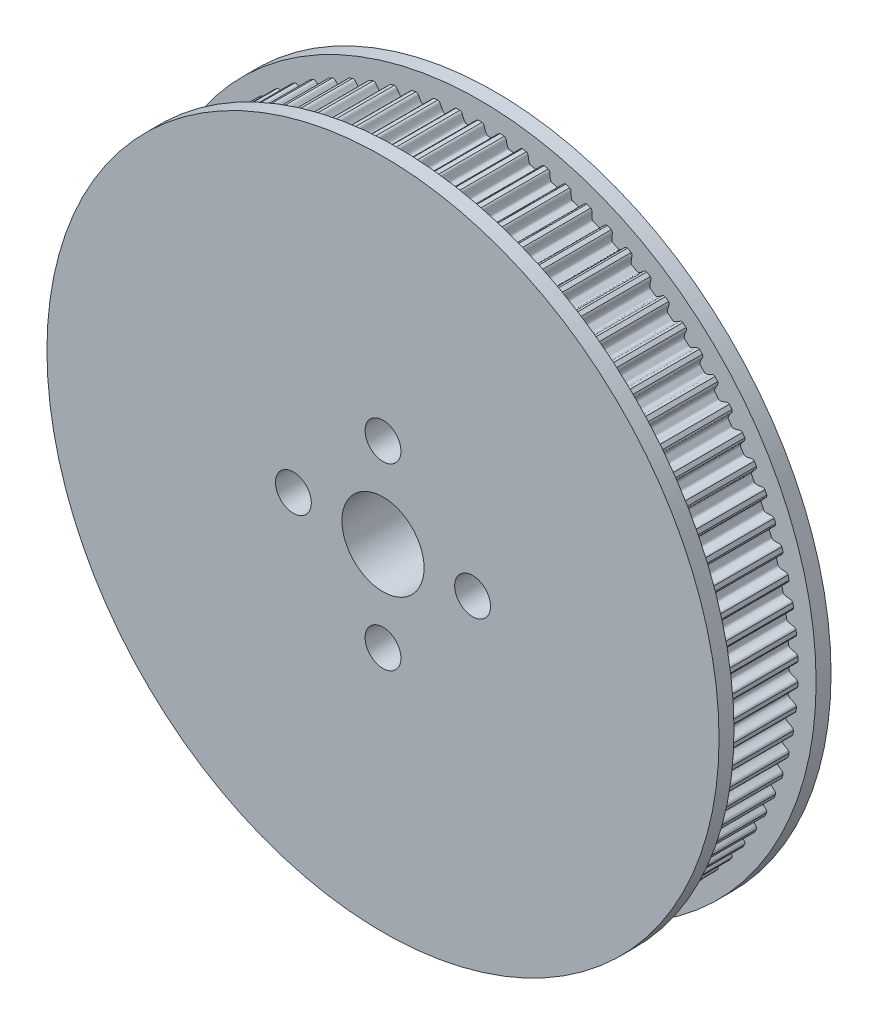
from build123d import *

# Parameters (mm, degrees)
TOOTHEXTRUDECUTGEARBELT01_DEPTH = 8.249999876
TOOTH_PATTERN_90_COUNT          = 90
BOREREVOLVESKETCH_W             = 19.547999706
BOREREVOLVESKETCH_H             = 5
SKETCH_5_R                      = 50.633765135
CUT_EXTRUDE_2_DEPTH             = 4.55
SKETCH_7_R                      = 52.583120945
CUT_EXTRUDE_3_DEPTH             = 4
SKETCH_8_R                      = 45
EXTRUDE_1_DEPTH                 = 2
EXTRUDE_START                   = 2
SKETCH_9_R                      = 45
EXTRUDE_2_DEPTH                 = 2
SKETCH_10_R                     = 5.5
CUT_EXTRUDE_4_DEPTH             = 20
SKETCH_11_R                     = 2.4
CUT_EXTRUDE_5_DEPTH             = 20


with BuildPart() as part:
    # SketchRevolveGearBelt01 → Gates_PowerGrip_GT_3mm, 15mm Belt Width (revolve)
    with BuildSketch(Plane(origin=(0, 0, 0), x_dir=(0, 0, -1), z_dir=(1, 0, 0))):
        Polygon((9.773999853, 0), (9.773999853, 40.571834025), (9.011999865, 40.571834025), (9.011999865, 42.820262768), (9.480047286, 43.950229199), (8.776051092, 44.24183397), (8.249999876, 42.971833989), (8.249999876, 42.576863995), (-8.249999876, 42.576863995), (-8.249999876, 42.971833989), (-8.776051092, 44.24183397), (-9.480047286, 43.950229199), (-9.011999865, 42.820262768), (-9.011999865, 40.571834025), (-9.773999853, 40.571834025), (-9.773999853, 0), align=None)
    revolve(axis=Axis((0, 0, 0), (0, 0, -1)))

    # SketchToothGearBelt01 → ToothExtrudeCutGearBelt01 (cut, symmetric)
    with BuildSketch(Plane.XY):
        with BuildLine():
            ThreePointArc((42.570725764, 1.290265667), (42.590274448, 0), (42.570725764, -1.290265667))
            add(Edge.make_bspline(
                [(42.570725764, -1.290265667), (42.570163561, -1.264815771), (42.565652905, -1.226724479), (42.55250539, -1.177479798), (42.539169753, -1.141654213), (42.522480037, -1.107262847), (42.502588372, -1.074618744), (42.479675736, -1.04401949), (42.453951182, -1.015742432), (42.425647407, -0.990049805), (42.395027856, -0.967157789), (42.362349979, -0.947341133), (42.327991027, -0.93053282), (42.261437843, -0.907027156), (42.178178578, -0.881939492), (42.08100079, -0.851219284), (42.002327889, -0.824733944), (41.928408694, -0.79827647), (41.859252834, -0.771815964), (41.794856322, -0.745360214), (41.735218051, -0.718907349), (41.680335606, -0.692457579), (41.630206127, -0.666010094), (41.584825872, -0.639563429), (41.5441903, -0.613114736), (41.508293673, -0.586658928), (41.477131039, -0.560187301), (41.450695062, -0.533685798), (41.428995431, -0.507133275), (41.412014367, -0.480502635), (41.399885618, -0.453766913), (41.392324511, -0.426922601), (41.389022661, -0.375466934), (41.393796037, -0.299989788), (41.394012118, -0.19995905), (41.395164912, -0.099984782), (41.395336018, 0), (41.395164912, 0.099984782), (41.394012118, 0.19995905), (41.393796037, 0.299989788), (41.389022661, 0.375466934), (41.392324511, 0.426922601), (41.399885618, 0.453766913), (41.412014367, 0.480502635), (41.428995431, 0.507133275), (41.450695062, 0.533685798), (41.477131039, 0.560187301), (41.508293673, 0.586658928), (41.5441903, 0.613114736), (41.584825872, 0.639563429), (41.630206127, 0.666010094), (41.680335606, 0.692457579), (41.735218051, 0.718907349), (41.794856322, 0.745360214), (41.859252834, 0.771815964), (41.928408694, 0.79827647), (42.002327889, 0.824733944), (42.08100079, 0.851219284), (42.178178578, 0.881939492), (42.261437843, 0.907027156), (42.327991027, 0.93053282), (42.362349979, 0.947341133), (42.395027856, 0.967157789), (42.425647407, 0.990049805), (42.453951182, 1.015742432), (42.479675736, 1.04401949), (42.502588372, 1.074618744), (42.522480037, 1.107262847), (42.539169753, 1.141654213), (42.55250539, 1.177479798), (42.565652905, 1.226724479), (42.570163561, 1.264815771), (42.570725764, 1.290265667)],
                knots=[0, 0, 0, 0, 0.019289316, 0.028933974, 0.038578632, 0.04822329, 0.057867948, 0.067512606, 0.077157264, 0.086801922, 0.09644658, 0.106091238, 0.115735896, 0.125380554, 0.159544896, 0.181661731, 0.202633763, 0.222468066, 0.241173002, 0.258758547, 0.275236708, 0.290622086, 0.304932627, 0.318190642, 0.330424203, 0.341669056, 0.351971244, 0.361390646, 0.370005564, 0.377918223, 0.385260238, 0.392195788, 0.398918898, 0.424207888, 0.449471925, 0.474735963, 0.5, 0.525264037, 0.550528075, 0.575792112, 0.601081102, 0.607804212, 0.614739762, 0.622081777, 0.629994436, 0.638609354, 0.648028756, 0.658330944, 0.669575797, 0.681809358, 0.695067373, 0.709377914, 0.724763292, 0.741241453, 0.758826998, 0.777531934, 0.797366237, 0.818338269, 0.840455104, 0.874619446, 0.884264104, 0.893908762, 0.90355342, 0.913198078, 0.922842736, 0.932487394, 0.942132052, 0.95177671, 0.961421368, 0.971066026, 0.980710684, 1, 1, 1, 1], degree=3))
        make_face()
    toothextrudecutgearbelt01 = extrude(amount=TOOTHEXTRUDECUTGEARBELT01_DEPTH, both=True, mode=Mode.SUBTRACT)

    # Tooth Pattern, 90: ToothExtrudeCutGearBelt01 ×90 about axis
    tooth_pattern_90_axis = Axis((0, 0, 55), (0, 0, -1))
    for i in range(1, TOOTH_PATTERN_90_COUNT):
        add(toothextrudecutgearbelt01.rotate(tooth_pattern_90_axis, i * 360 / TOOTH_PATTERN_90_COUNT), mode=Mode.SUBTRACT)

    # BoreRevolveSketch → BoreRevolveCut (revolve, cut)
    with BuildSketch(Plane(origin=(0, 0, 0), x_dir=(0, 0, -1), z_dir=(1, 0, 0))):
        with Locations((0, 2.5)):
            Rectangle(BOREREVOLVESKETCH_W, BOREREVOLVESKETCH_H)
    revolve(axis=Axis((0, 0, 0), (0, 0, -1)), mode=Mode.SUBTRACT)

    # 草图5 → 切除-拉伸2 (cut)
    with BuildSketch(Plane.XY.offset(9.773999853)):
        Circle(SKETCH_5_R)
    extrude(amount=-CUT_EXTRUDE_2_DEPTH, mode=Mode.SUBTRACT)

    # 草图7 → 切除-拉伸3 (cut)
    with BuildSketch(Plane(origin=(0, 0, -9.773999853), x_dir=(-1, 0, 0), z_dir=(0, 0, -1))):
        Circle(SKETCH_7_R)
    extrude(amount=-CUT_EXTRUDE_3_DEPTH, mode=Mode.SUBTRACT)

    # 草图8 → 凸台-拉伸1 (add)
    with BuildSketch(Plane.XY.offset(5.223999853)):
        Circle(SKETCH_8_R)
    extrude(amount=EXTRUDE_1_DEPTH)

    # 草图9 → 凸台-拉伸2 (add)
    with BuildSketch(Plane(origin=(0, 0, -5.773999853), x_dir=(-1, 0, 0), z_dir=(0, 0, -1)).offset(EXTRUDE_START)):
        Circle(SKETCH_9_R)
    extrude(amount=-EXTRUDE_2_DEPTH)

    # 草图10 → 切除-拉伸4 (cut)
    with BuildSketch(Plane(origin=(0, 0, -7.773999853), x_dir=(-1, 0, 0), z_dir=(0, 0, -1))):
        Circle(SKETCH_10_R)
    extrude(amount=-CUT_EXTRUDE_4_DEPTH, mode=Mode.SUBTRACT)

    # 草图11 → 切除-拉伸5 (cut)
    with BuildSketch(Plane.XY.offset(7.223999853)):
        with Locations((0, 12)):
            Circle(SKETCH_11_R)
        with Locations((12, 0)):
            Circle(SKETCH_11_R)
        with Locations((0, -12)):
            Circle(SKETCH_11_R)
        with Locations((-12, 0)):
            Circle(SKETCH_11_R)
    extrude(amount=-CUT_EXTRUDE_5_DEPTH, mode=Mode.SUBTRACT)


solid = part.part
